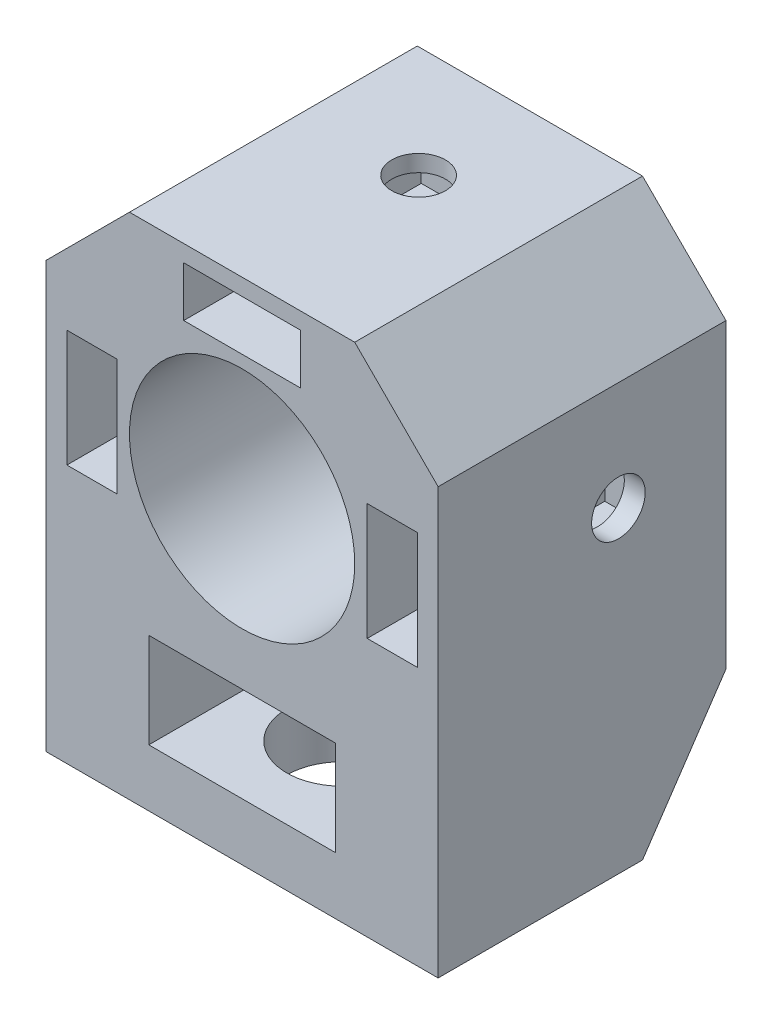
from build123d import *

# Parameters (mm, degrees)
SKETCH1_W                   = 23.876
SKETCH1_H                   = 23.368
BOSS_EXTRUDE1_DEPTH         = 17.526
SKETCH2_R                   = 6.858
CUT_EXTRUDE2_DEPTH          = 15.748
SKETCH3_R                   = 5.08
CUT_EXTRUDE3_DEPTH          = 1.778
SKETCH4_W                   = 23.876
SKETCH4_H                   = 17.526
BOSS_EXTRUDE2_DEPTH         = 7.62
SKETCH6_W                   = 11.362672476
SKETCH6_H                   = 5.777630073
CUT_EXTRUDE5_DEPTH          = 29.676138792
CHAMFER1_SIZE               = 5.08
CHAMFER1_SIZE_2             = 7.53140972
F_1_4_CLEARANCE_HOLE1_D     = 6.7564
F_1_4_CLEARANCE_HOLE1_DEPTH = 3.484763225
SKETCH10_W                  = 7.112
SKETCH10_H                  = 3.048
SKETCH10_W_2                = 3.048
SKETCH10_H_2                = 7.112
CUT_EXTRUDE6_DEPTH          = 14.4653
F_4_CLEARANCE_HOLE1_D       = 3.2639
F_4_CLEARANCE_HOLE1_DEPTH   = 6.604
F_4_CLEARANCE_HOLE1_TIP     = 0.980574487
F_4_CLEARANCE_HOLE2_D       = 3.2639
CHAMFER2_SIZE               = 5.08


with BuildPart() as part:
    # Sketch1 → Boss-Extrude1 (new body)
    with BuildSketch(Plane.XY):
        Rectangle(SKETCH1_W, SKETCH1_H)
    extrude(amount=BOSS_EXTRUDE1_DEPTH)

    # Sketch2 → Cut-Extrude2 (cut)
    with BuildSketch(Plane.XY.offset(17.526)):
        Circle(SKETCH2_R)
    extrude(amount=-CUT_EXTRUDE2_DEPTH, mode=Mode.SUBTRACT)

    # Sketch3 → Cut-Extrude3 (cut)
    with BuildSketch(Plane.XY.offset(1.778)):
        Circle(SKETCH3_R)
    extrude(amount=-CUT_EXTRUDE3_DEPTH, mode=Mode.SUBTRACT)

    # Sketch4 → Boss-Extrude2 (add)
    with BuildSketch(Plane.XZ.offset(11.684)):
        with Locations((0, 8.763)):
            Rectangle(SKETCH4_W, SKETCH4_H)
    extrude(amount=BOSS_EXTRUDE2_DEPTH)

    # Sketch6 → Cut-Extrude5 (cut, through all)
    with BuildSketch(Plane.XY.offset(17.526)):
        with Locations((0, -12.930421739)):
            Rectangle(SKETCH6_W, SKETCH6_H)
    extrude(amount=-CUT_EXTRUDE5_DEPTH, mode=Mode.SUBTRACT)

    # Chamfer1
    # the kernel refuses this chamfer: 7.53140972, 5.08 mm, written as the material it takes off along each edge
    with BuildSketch(Plane(origin=(-31.395464843, -19.304, 0), x_dir=(0, -0.04753214298802828, 0.9988697089125115), z_dir=(1, 0, 0))) as chamfer1_piece_1:
        Polygon((CHAMFER1_SIZE * 0.998869708913, -CHAMFER1_SIZE * 0.047532142988), (-CHAMFER1_SIZE_2 * 0.0475321429883, -CHAMFER1_SIZE_2 * 0.998869708918), (0, 0), align=None)
    extrude(amount=62.790929686, mode=Mode.SUBTRACT)

    # 1/4 Clearance Hole1
    with Locations(Plane(origin=(0, -19.304, 0), x_dir=(-1, 0, 0), z_dir=(0, -1, 0))):
        with Locations((0, -11.43)):
            Hole(F_1_4_CLEARANCE_HOLE1_D / 2, depth=F_1_4_CLEARANCE_HOLE1_DEPTH)

    # Sketch10 → Cut-Extrude6 (cut)
    with BuildSketch(Plane.XY.offset(17.526)):
        with Locations((0, 9.144)):
            Rectangle(SKETCH10_W, SKETCH10_H)
        with Locations((9.144, 0)):
            Rectangle(SKETCH10_W_2, SKETCH10_H_2)
        with Locations((-9.144, 0)):
            Rectangle(SKETCH10_W_2, SKETCH10_H_2)
    extrude(amount=-CUT_EXTRUDE6_DEPTH, mode=Mode.SUBTRACT)

    # #4 Clearance Hole1
    with Locations(Plane(origin=(0, 11.684, 0), x_dir=(1, 0, 0), z_dir=(0, 1, 0))):
        with Locations((0, -6.777873248)):
            Hole(F_4_CLEARANCE_HOLE1_D / 2, depth=F_4_CLEARANCE_HOLE1_DEPTH)
            with Locations((0, 0, -(F_4_CLEARANCE_HOLE1_DEPTH + F_4_CLEARANCE_HOLE1_TIP / 2))):  # 118° drill point
                Cone(0, F_4_CLEARANCE_HOLE1_D / 2, F_4_CLEARANCE_HOLE1_TIP, mode=Mode.SUBTRACT)

    # #4 Clearance Hole2 (through all)
    with Locations(Plane(origin=(11.938, 0, 0), x_dir=(0, 0, -1), z_dir=(1, 0, 0))):
        with Locations((-6.548240248, 0)):
            f_4_clearance_hole2 = Hole(F_4_CLEARANCE_HOLE2_D / 2)

    # Mirror1: #4 Clearance Hole2 across plane
    add(f_4_clearance_hole2.mirror(Plane(origin=(0, 0, 0), x_dir=(0, 0, 1), z_dir=(1, 0, 0))), mode=Mode.SUBTRACT)

    # Chamfer2
    chamfer2_edges = [part.edges().sort_by_distance(p)[0] for p in [
        (-11.938, 11.684, 8.763),
        (11.938, 11.684, 8.763),
    ]]
    chamfer(chamfer2_edges, length=CHAMFER2_SIZE)


solid = part.part
